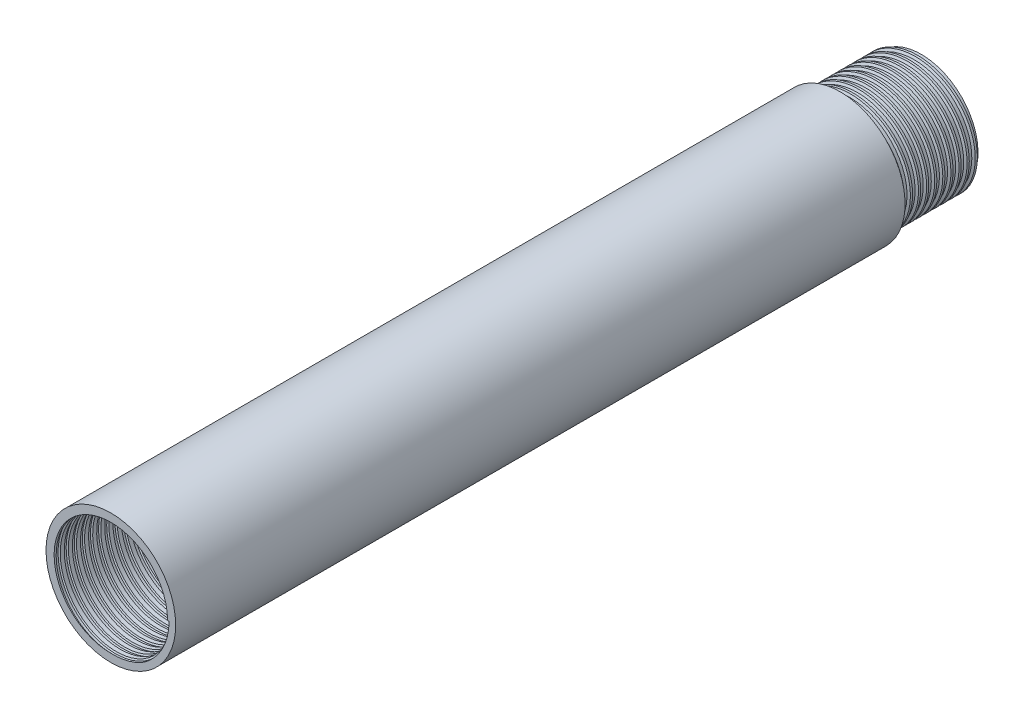
from build123d import *

# Parameters (mm, degrees)
SKETCH1_R           = 12
SKETCH1_R_2         = 9
BOSS_EXTRUDE1_DEPTH = 150
SKETCH2_R           = 12
SKETCH2_R_2         = 10.5
CUT_EXTRUDE1_DEPTH  = 15
CUT_EXTRUDE3_START  = -15
SKETCH8_R           = 10.5
SKETCH8_R_2         = 9
CUT_EXTRUDE3_DEPTH  = 15
CUT_SWEEP1_PITCH    = 1.5
SWEEP3_PITCH        = 1.5
SKETCH13_R          = 12.763282113
CUT_EXTRUDE4_DEPTH  = 5
BOSS_EXTRUDE2_START = -3
SKETCH14_R          = 9
SKETCH14_R_2        = 6.362734618
BOSS_EXTRUDE2_DEPTH = 3


with BuildPart() as part:
    # Sketch1 → Boss-Extrude1 (new body)
    with BuildSketch(Plane.XY):
        Circle(SKETCH1_R)
        Circle(SKETCH1_R_2, mode=Mode.SUBTRACT)
    extrude(amount=BOSS_EXTRUDE1_DEPTH)

    # Sketch2 → Cut-Extrude1 (cut)
    with BuildSketch(Plane(origin=(0, 0, 0), x_dir=(-1, 0, 0), z_dir=(0, 0, -1))):
        Circle(SKETCH2_R)
        Circle(SKETCH2_R_2, mode=Mode.SUBTRACT)
    extrude(amount=-CUT_EXTRUDE1_DEPTH, mode=Mode.SUBTRACT)

    # Sketch8 → Cut-Extrude3 (cut)
    with BuildSketch(Plane.XY.offset(150).offset(CUT_EXTRUDE3_START)):
        with Locations(Location((0, 0, 0), (0, 0, 180))):
            Circle(SKETCH8_R)
        Circle(SKETCH8_R_2, mode=Mode.SUBTRACT)
    extrude(amount=CUT_EXTRUDE3_DEPTH, mode=Mode.SUBTRACT)

    # Cut-Sweep1: arcs per turn and ends read off the stored shape
    # Cut-Sweep1: the profile of Sketch10 screwed along a right-hand helix through 10 turns, 8 arcs to a turn; built about Z, then put on its axis
    cut_sweep1_z = Axis((0, 0, 0), (0, 0, 1))
    cut_sweep1_corners = [(10.238733771, 0, 0.511138395), (10.238733771, 0, -0.488861605), (10.774860501, 0, -0.238861605), (10.774860501, 0, 0.261138395)]
    with BuildLine(mode=Mode.PRIVATE) as cut_sweep1_profile:
        Line(cut_sweep1_corners[0], cut_sweep1_corners[1])
        Line(cut_sweep1_corners[1], cut_sweep1_corners[2])
        Line(cut_sweep1_corners[2], cut_sweep1_corners[3])
        Line(cut_sweep1_corners[3], cut_sweep1_corners[0])
    cut_sweep1_cap = Face(cut_sweep1_profile.wire())
    cut_sweep1_turn_angles = [0, 22.5, 45, 67.5, 90, 112.5, 135, 157.5, 180, 202.5, 225, 247.5, 270, 292.5, 315, 337.5, 360]
    cut_sweep1_turn_weights = [1, 0.9238795325112867, 1, 0.9238795325112867, 1, 0.9238795325112867, 1, 0.9238795325112867, 1, 0.9238795325112867, 1, 0.9238795325112867, 1, 0.9238795325112867, 1, 0.9238795325112867, 1]
    cut_sweep1_turn_rails = [Edge.make_bspline([Vector(p[0], p[1], 0).rotate(cut_sweep1_z, cut_sweep1_turn_angles[k]) / cut_sweep1_turn_weights[k] + Vector(0, 0, p[2] + CUT_SWEEP1_PITCH * cut_sweep1_turn_angles[k] / 360) for k in range(17)], [0, 0, 0, 1, 1, 2, 2, 3, 3, 4, 4, 5, 5, 6, 6, 7, 7, 8, 8, 8], 2, cut_sweep1_turn_weights) for p in cut_sweep1_corners]
    cut_sweep1_turn_sides = [Face.make_surface_from_curves(cut_sweep1_turn_rails[p[0]], cut_sweep1_turn_rails[p[1]]) for p in [(0, 1), (1, 2), (2, 3), (3, 0)]]
    cut_sweep1 = Plane(origin=(0, 0, 150), x_dir=(1, 0, 0), z_dir=(0, 0, -1)) * Solid(Shell([*[p.moved(Location((0, 0, CUT_SWEEP1_PITCH * i))) for i in range(10) for p in cut_sweep1_turn_sides], cut_sweep1_cap, cut_sweep1_cap.rotate(cut_sweep1_z, 3600).moved(Location((0, 0, CUT_SWEEP1_PITCH * 3600 / 360)))]))
    add(cut_sweep1, mode=Mode.SUBTRACT)

    # Sweep3: arcs per turn and ends read off the stored shape
    # Sweep3: the profile of Sketch12 profile screwed along a right-hand helix through 10 turns, 8 arcs to a turn; built about Z, then put on its axis
    sweep3_z = Axis((0, 0, 0), (0, 0, 1))
    sweep3_corners = [(10.4997, 0, 0.400139892), (10.4997, 0, -0.400139892), (10.928901384, 0, -0.2), (10.928901384, 0, 0.2)]
    with BuildLine(mode=Mode.PRIVATE) as sweep3_profile:
        Line(sweep3_corners[0], sweep3_corners[1])
        Line(sweep3_corners[1], sweep3_corners[2])
        Line(sweep3_corners[2], sweep3_corners[3])
        Line(sweep3_corners[3], sweep3_corners[0])
    sweep3_cap = Face(sweep3_profile.wire())
    sweep3_turn_angles = [0, 22.5, 45, 67.5, 90, 112.5, 135, 157.5, 180, 202.5, 225, 247.5, 270, 292.5, 315, 337.5, 360]
    sweep3_turn_weights = [1, 0.9238795325112867, 1, 0.9238795325112867, 1, 0.9238795325112867, 1, 0.9238795325112867, 1, 0.9238795325112867, 1, 0.9238795325112867, 1, 0.9238795325112867, 1, 0.9238795325112867, 1]
    sweep3_turn_rails = [Edge.make_bspline([Vector(p[0], p[1], 0).rotate(sweep3_z, sweep3_turn_angles[k]) / sweep3_turn_weights[k] + Vector(0, 0, p[2] + SWEEP3_PITCH * sweep3_turn_angles[k] / 360) for k in range(17)], [0, 0, 0, 1, 1, 2, 2, 3, 3, 4, 4, 5, 5, 6, 6, 7, 7, 8, 8, 8], 2, sweep3_turn_weights) for p in sweep3_corners]
    sweep3_turn_sides = [Face.make_surface_from_curves(sweep3_turn_rails[p[0]], sweep3_turn_rails[p[1]]) for p in [(0, 1), (1, 2), (2, 3), (3, 0)]]
    sweep3 = Plane(origin=(0, 0, 0), x_dir=(-1, 0, 0), z_dir=(0, 0, 1)) * Solid(Shell([*[p.moved(Location((0, 0, SWEEP3_PITCH * i))) for i in range(10) for p in sweep3_turn_sides], sweep3_cap, sweep3_cap.rotate(sweep3_z, 3600).moved(Location((0, 0, SWEEP3_PITCH * 3600 / 360)))]))
    add(sweep3)

    # Sketch13 → Cut-Extrude4 (cut)
    with BuildSketch(Plane(origin=(0, 0, 0), x_dir=(-1, 0, 0), z_dir=(0, 0, -1))):
        Circle(SKETCH13_R)
    extrude(amount=CUT_EXTRUDE4_DEPTH, mode=Mode.SUBTRACT)

    # Sketch14 → Boss-Extrude2 (add)
    with BuildSketch(Plane.XY.offset(135).offset(BOSS_EXTRUDE2_START)):
        Circle(SKETCH14_R)
        Circle(SKETCH14_R_2, mode=Mode.SUBTRACT)
    extrude(amount=BOSS_EXTRUDE2_DEPTH)


solid = part.part
